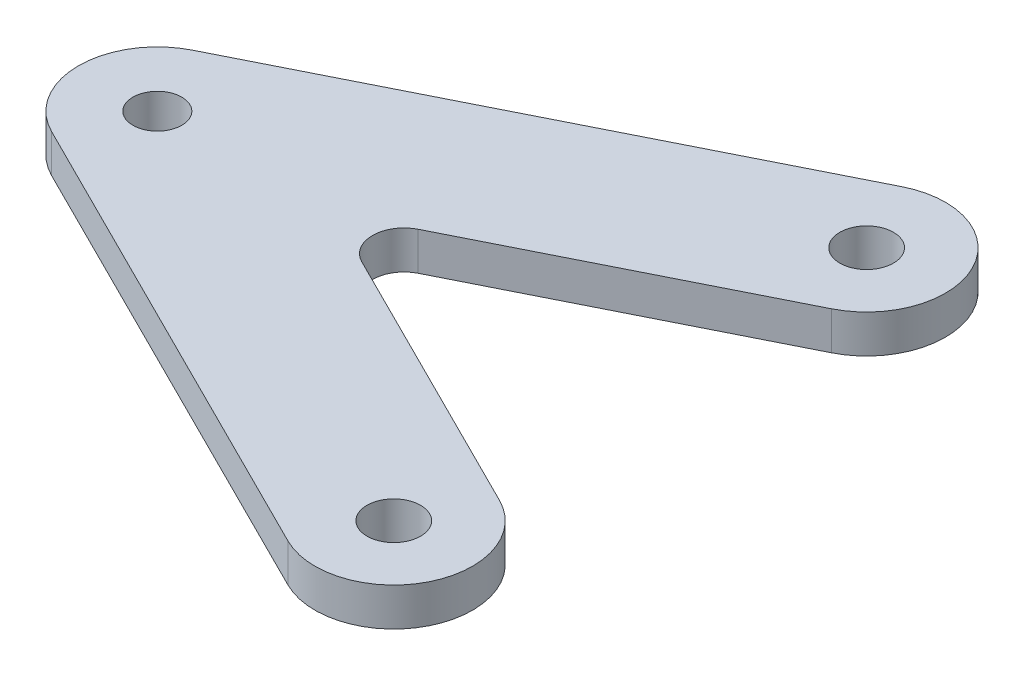
from build123d import *

# Parameters (mm, degrees)
SKETCH8_R            = 1.55
BASE_FLANGE2_DEPTH   = 2.42
M3_CLEARANCE_HOLE3_D = 3.4


# Sheet-metal steps are written as plain solids
with BuildPart() as part:
    # Sketch8 → Base-Flange2 (new body)
    with BuildSketch(Plane(origin=(0, 0, 0), x_dir=(1, 0, 0), z_dir=(0, 1, 0))):
        with BuildLine():
            Line((27.763932023, 19.472135955), (-2.236067977, 4.472135955))
            ThreePointArc((-2.236067977, 4.472135955), (-5, 0), (-2.236067977, -4.472135955))
            Line((-2.236067977, -4.472135955), (27.763932023, -19.472135955))
            ThreePointArc((27.763932023, -19.472135955), (34.472135955, -17.236067977), (32.236067977, -10.527864045))
            Line((32.236067977, -10.527864045), (14.758048651, -1.788854382))
            ThreePointArc((14.758048651, -1.788854382), (13.652475842, 0), (14.758048651, 1.788854382))
            Line((14.758048651, 1.788854382), (32.236067977, 10.527864045))
            ThreePointArc((32.236067977, 10.527864045), (34.472135955, 17.236067977), (27.763932023, 19.472135955))
        make_face()
        with Locations(Location((0, 0, 0), (0, 0, 270))):
            Circle(SKETCH8_R, mode=Mode.SUBTRACT)
    extrude(amount=-BASE_FLANGE2_DEPTH)

    # M3 Clearance Hole3 (through all)
    with Locations(Plane(origin=(0, 0, 0), x_dir=(1, 0, 0), z_dir=(0, 1, 0))):
        with Locations((30, 15), (30, -15)):
            Hole(M3_CLEARANCE_HOLE3_D / 2)


solid = part.part
